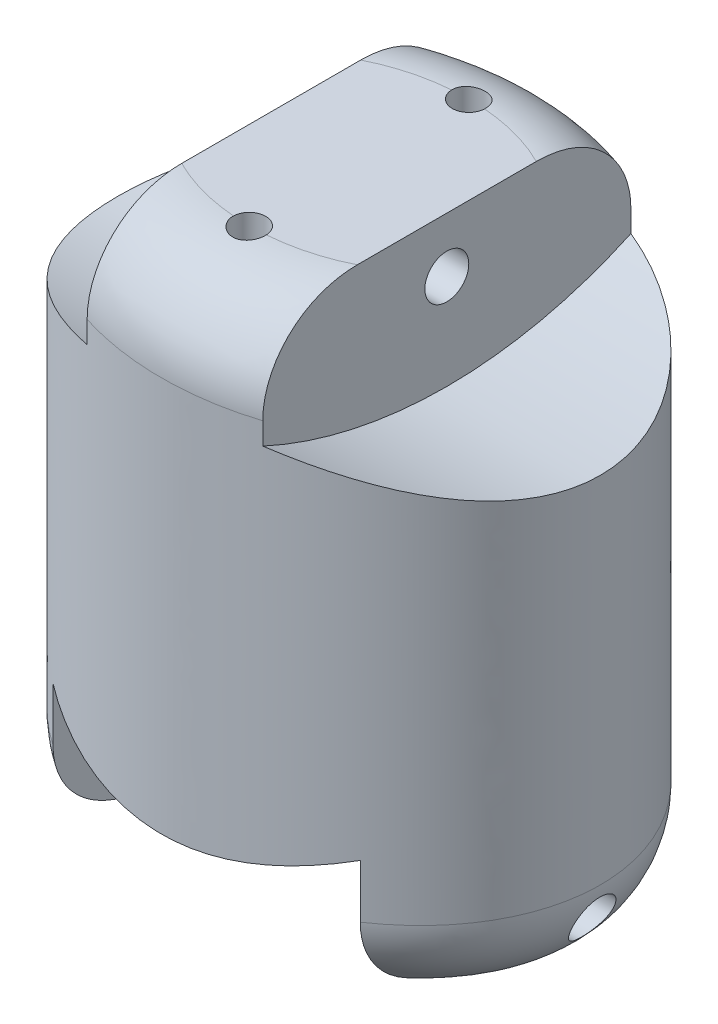
from build123d import *

# Parameters (mm, degrees)
SKETCH1_RX              = 13.97
SKETCH1_RY              = 11.43
BOSS_EXTRUDE1_DEPTH     = 34.29
FILLET1_R               = 5.08
CUT_EXTRUDE1_DEPTH      = 39.750611762
CUT_EXTRUDE1_DEPTH_BACK = 39.750611762
SKETCH2_W               = 17.78
SKETCH2_H               = 6.35
CUT_EXTRUDE2_DEPTH      = 43.767144091
CUT_EXTRUDE2_DEPTH_BACK = 43.767144091
SKETCH3_R               = 1.27
CUT_EXTRUDE3_DEPTH      = 34.263334329
CUT_EXTRUDE3_DEPTH_BACK = 34.263334329
SKETCH4_R               = 0.9525
CUT_EXTRUDE4_DEPTH      = 39.750611762
CUT_EXTRUDE4_DEPTH_BACK = 39.750611762
CUT_EXTRUDE5_DEPTH      = 42.7799119
CUT_EXTRUDE5_DEPTH_BACK = 42.7799119
SKETCH6_R               = 1.27
CUT_EXTRUDE6_DEPTH      = 41.857698332
CUT_EXTRUDE7_DEPTH      = 41.857698332
CUT_EXTRUDE8_DEPTH      = 17.78


with BuildPart() as part:
    # Sketch1 → Boss-Extrude1 (new body)
    with BuildSketch(Plane(origin=(0, 0, 0), x_dir=(1, 0, 0), z_dir=(0, 1, 0))):
        with Locations((0, 0)):
            Ellipse(SKETCH1_RX, SKETCH1_RY)
    extrude(amount=BOSS_EXTRUDE1_DEPTH)

    # Fillet1
    fillet1_edges = [part.edges().sort_by_distance(p)[0] for p in [
        (-13.969999912, 0, 0.001283289),
        (-13.969999912, 34.29, 0.001283289),
    ]]
    fillet(fillet1_edges, radius=FILLET1_R)

    # Sketch2 → Cut-Extrude1 (cut, two sides: drawn at the far end of the back side and taken through both)
    with BuildSketch(Plane.XY.offset(-CUT_EXTRUDE1_DEPTH_BACK)):
        with Locations((0, 3.175)):
            Rectangle(SKETCH2_W, SKETCH2_H)
    extrude(amount=CUT_EXTRUDE1_DEPTH + CUT_EXTRUDE1_DEPTH_BACK, mode=Mode.SUBTRACT)

    # Sketch3 → Cut-Extrude2 (cut, two sides: drawn at the far end of the back side and taken through both)
    with BuildSketch(Plane(origin=(-8.89, 0, 0), x_dir=(0, 0, -1), z_dir=(1, 0, 0)).offset(-CUT_EXTRUDE2_DEPTH_BACK)):
        with Locations((0, 3.175)):
            Circle(SKETCH3_R)
    extrude(amount=CUT_EXTRUDE2_DEPTH + CUT_EXTRUDE2_DEPTH_BACK, mode=Mode.SUBTRACT)

    # Sketch4 → Cut-Extrude3 (cut, two sides: drawn at the far end of the back side and taken through both)
    with BuildSketch(Plane(origin=(0, 6.35, 0), x_dir=(-1, 0, 0), z_dir=(0, -1, 0)).offset(-CUT_EXTRUDE3_DEPTH_BACK)):
        with Locations(Location((0, -6.35, 0), (0, 0, 177.721891721))):
            Circle(SKETCH4_R)
        with Locations(Location((0, 6.35, 0), (0, 0, 357.721891721))):
            Circle(SKETCH4_R)
    extrude(amount=CUT_EXTRUDE3_DEPTH + CUT_EXTRUDE3_DEPTH_BACK, mode=Mode.SUBTRACT)

    # Sketch5 → Cut-Extrude4 (cut, two sides: drawn at the far end of the back side and taken through both)
    with BuildSketch(Plane.XY.offset(-CUT_EXTRUDE4_DEPTH_BACK)):
        Polygon((-5.08, 34.29), (-8.890001602, 34.29), (-13.97, 34.29), (-13.97, 27.94), (-6.985, 27.94), (-5.08, 27.94), align=None)
        Polygon((8.890001602, 34.29), (5.08, 34.29), (5.08, 27.94), (6.985, 27.94), (13.97, 27.94), (13.97, 34.29), align=None)
    extrude(amount=CUT_EXTRUDE4_DEPTH + CUT_EXTRUDE4_DEPTH_BACK, mode=Mode.SUBTRACT)

    # Sketch6 → Cut-Extrude5 (cut, two sides: drawn at the far end of the back side and taken through both)
    with BuildSketch(Plane(origin=(6.985, 0, 0), x_dir=(0, 0, -1), z_dir=(1, 0, 0)).offset(-CUT_EXTRUDE5_DEPTH_BACK)):
        with Locations((5.907e-06, 31.115)):
            Circle(SKETCH6_R)
    extrude(amount=CUT_EXTRUDE5_DEPTH + CUT_EXTRUDE5_DEPTH_BACK, mode=Mode.SUBTRACT)

    # Sketch7 → Cut-Extrude6 (cut, through all)
    with BuildSketch(Plane(origin=(5.08, 0, 0), x_dir=(0, 0, -1), z_dir=(1, 0, 0))):
        with BuildLine():
            Line((-10.647513387, 27.94), (10.647513387, 27.94))
            ThreePointArc((10.647513387, 27.94), (0, 25.600582358), (-10.647513387, 27.94))
        make_face()
    extrude(amount=CUT_EXTRUDE6_DEPTH, mode=Mode.SUBTRACT)

    # Sketch8 → Cut-Extrude7 (cut, through all)
    with BuildSketch(Plane.ZY.offset(5.08)):
        with BuildLine():
            Line((-10.647513387, 27.94), (10.647513387, 27.94))
            ThreePointArc((10.647513387, 27.94), (0, 25.600582358), (-10.647513387, 27.94))
        make_face()
    extrude(amount=CUT_EXTRUDE7_DEPTH, mode=Mode.SUBTRACT)

    # Sketch9 → Cut-Extrude8 (cut)
    with BuildSketch(Plane(origin=(-8.89, 0, 0), x_dir=(0, 0, -1), z_dir=(1, 0, 0))):
        with BuildLine():
            Line((-11.43, 6.35), (11.43, 6.35))
            ThreePointArc((11.43, 6.35), (0, 10.510767276), (-11.43, 6.35))
        make_face()
    extrude(amount=CUT_EXTRUDE8_DEPTH, mode=Mode.SUBTRACT)


solid = part.part
